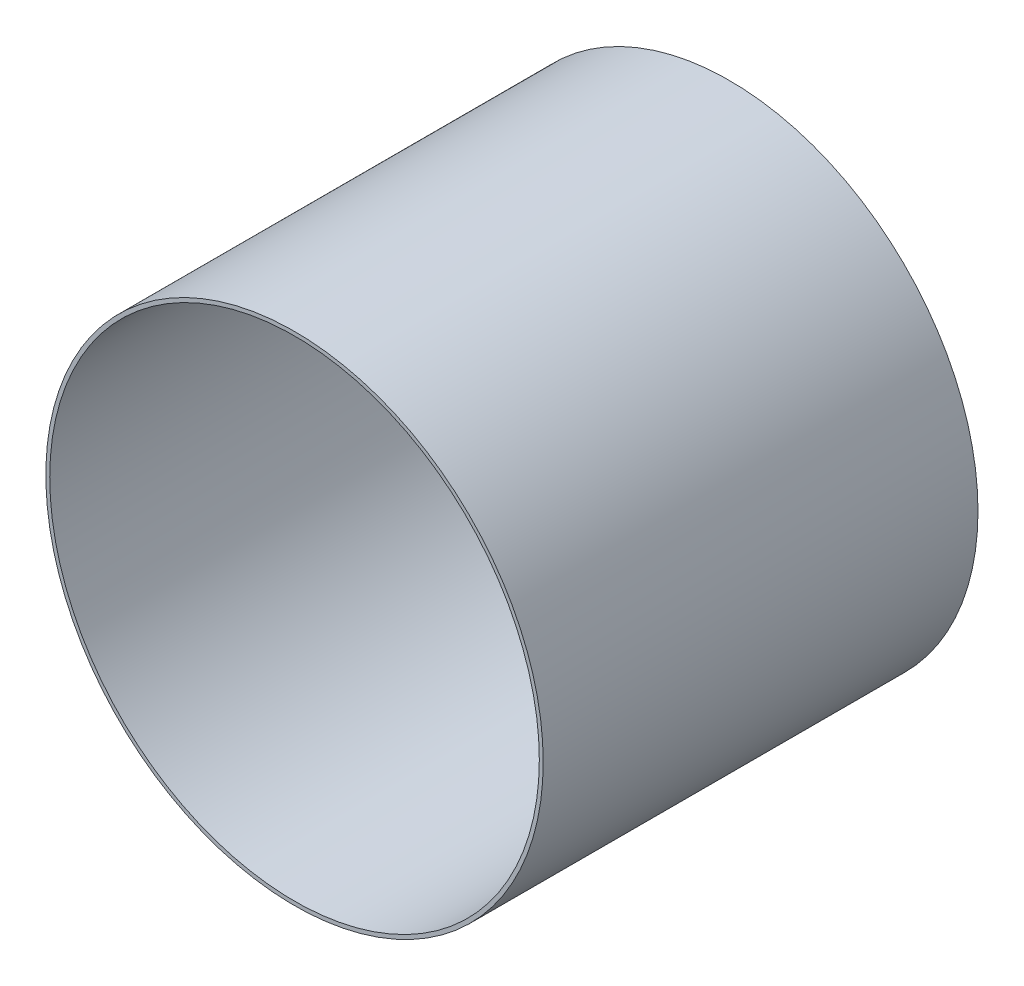
from build123d import *

# Parameters (mm, degrees)
SCHIZZO1_R                   = 446.9
SCHIZZO1_R_2                 = 439.9
ESTRUSIONE_ESTRUSIONE1_DEPTH = 781.3


with BuildPart() as part:
    # Schizzo1 → Estrusione-Estrusione1 (new body)
    with BuildSketch(Plane.XY):
        Circle(SCHIZZO1_R)
        Circle(SCHIZZO1_R_2, mode=Mode.SUBTRACT)
    extrude(amount=ESTRUSIONE_ESTRUSIONE1_DEPTH)


solid = part.part
